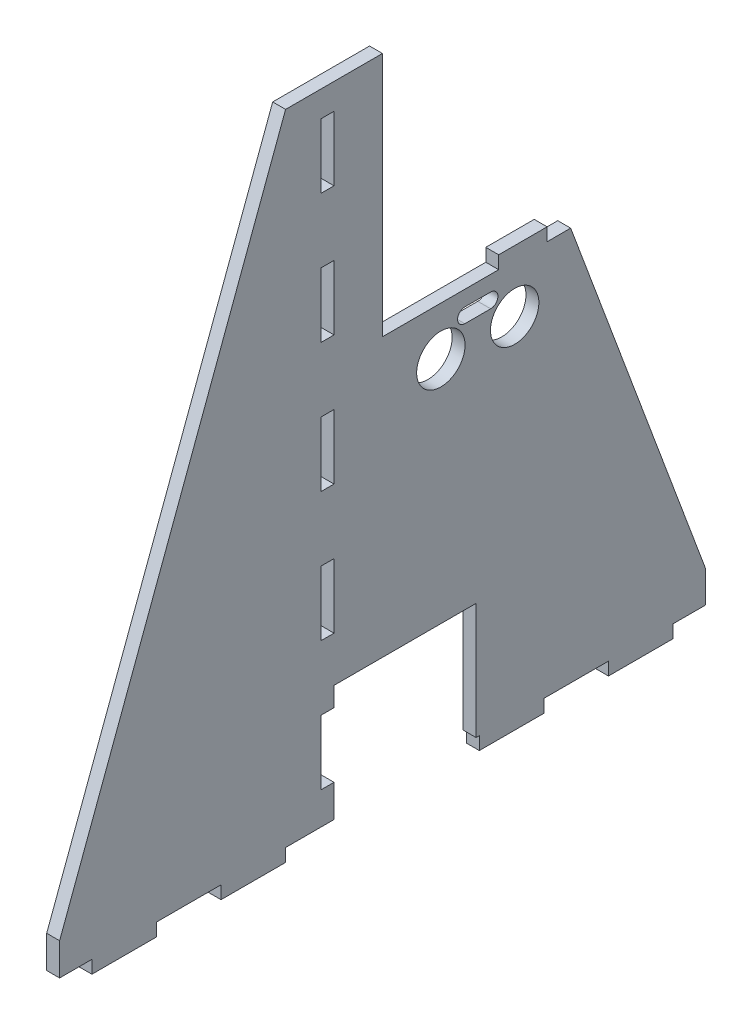
from build123d import *

# Parameters (mm, degrees)
SKICA1_W                = 4
SKICA1_H                = 20
SKICA1_R                = 7.5
P_IDAT_VYSUNUT_M1_DEPTH = 4


with BuildPart() as part:
    # Skica1 → Přidat vysunutím1 (new body)
    with BuildSketch(Plane(origin=(0, 0, 0), x_dir=(0, 0, -1), z_dir=(1, 0, 0))):
        Polygon((-15, 40), (29, 40), (29, 4), (30, 4), (30, 0), (50, 0), (50, 4), (70, 4), (70, 0), (90, 0), (90, 4), (100, 4), (100, 14), (58.29787234, 126), (51, 126), (51, 130), (36, 130), (36, 126), (0, 126), (0, 202), (-30, 202), (-100, 14), (-100, 4), (-90, 4), (-90, 0), (-70, 0), (-70, 4), (-50, 4), (-50, 0), (-30, 0), (-30, 4), (-15, 4), (-15, 14), (-19, 14), (-19, 34), (-15, 34), align=None)
        with Locations((-17, 64)):
            Rectangle(SKICA1_W, SKICA1_H, mode=Mode.SUBTRACT)
        with Locations((-17, 104)):
            Rectangle(SKICA1_W, SKICA1_H, mode=Mode.SUBTRACT)
        with Locations((-17, 144)):
            Rectangle(SKICA1_W, SKICA1_H, mode=Mode.SUBTRACT)
        with Locations((-17, 184)):
            Rectangle(SKICA1_W, SKICA1_H, mode=Mode.SUBTRACT)
        with BuildLine():
            Line((25.52225545, 121.25), (33.52225545, 121.25))
            ThreePointArc((33.52225545, 121.25), (35.77225545, 119), (33.52225545, 116.75))
            Line((33.52225545, 116.75), (25.52225545, 116.75))
            ThreePointArc((25.52225545, 116.75), (23.27225545, 119), (25.52225545, 121.25))
        make_face(mode=Mode.SUBTRACT)
        with Locations((18.09225545, 111)):
            Circle(SKICA1_R, mode=Mode.SUBTRACT)
        with Locations((40.95225545, 111)):
            Circle(SKICA1_R, mode=Mode.SUBTRACT)
    extrude(amount=P_IDAT_VYSUNUT_M1_DEPTH)


solid = part.part
